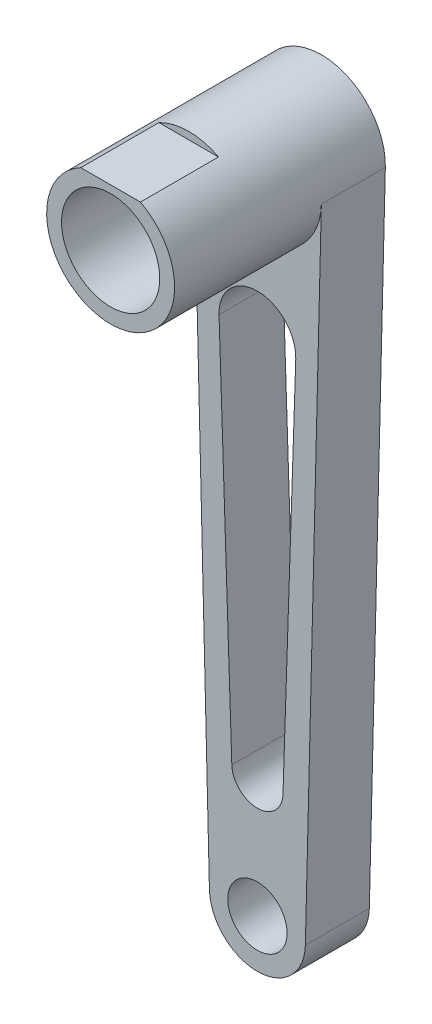
from build123d import *

# Parameters (mm, degrees)
SKETCH1_R           = 4.635
BOSS_EXTRUDE2_DEPTH = 10
SKETCH1_6_R         = 7.675
BOSS_EXTRUDE3_DEPTH = 32.94
SKETCH2_W           = 20.025396677
SKETCH2_H           = 9.808205023
CUT_EXTRUDE1_DEPTH  = 12.2


with BuildPart() as part:
    # Sketch1 → Boss-Extrude2 (new body)
    with BuildSketch(Plane.XY):
        with BuildLine():
            ThreePointArc((9.996972197, -0.246062766), (5.5e-08, -10), (-9.996972195, -0.246062876))
            Line((-9.996972195, -0.246062876), (-7.497729139, -101.784547426))
            ThreePointArc((-7.497729139, -101.784547426), (1.58e-07, -109.1), (7.497729147, -101.784547111))
            Line((7.497729147, -101.784547111), (9.996972197, -0.246062766))
        make_face()
        with BuildLine():
            Line((5.996665744, -23.199999888), (3.997777167, -83.133333141))
            ThreePointArc((3.997777167, -83.133333141), (1.93e-07, -87), (-3.997777154, -83.133333527))
            Line((-3.997777154, -83.133333527), (-5.996665745, -23.199999845))
            ThreePointArc((-5.996665745, -23.199999845), (2.1e-08, -17), (5.996665744, -23.199999888))
        make_face(mode=Mode.SUBTRACT)
        with Locations((0, -101.6)):
            Circle(SKETCH1_R, mode=Mode.SUBTRACT)
    extrude(amount=BOSS_EXTRUDE2_DEPTH)

    # Sketch1<6> → Boss-Extrude3 (add)
    with BuildSketch(Plane.XY):
        with BuildLine():
            ThreePointArc((10, 0), (-0.123040752, 9.99924302), (-9.996972195, -0.246062876))
            ThreePointArc((-9.996972195, -0.246062876), (5.5e-08, -10), (9.996972197, -0.246062766))
            ThreePointArc((9.996972197, -0.246062766), (9.999243021, -0.123040697), (10, 0))
        make_face()
        Circle(SKETCH1_6_R, mode=Mode.SUBTRACT)
    extrude(amount=BOSS_EXTRUDE3_DEPTH)

    # Sketch2 → Cut-Extrude1 (cut)
    with BuildSketch(Plane.XY.offset(32.94)):
        with Locations((-0.020605473, 13.754102512)):
            Rectangle(SKETCH2_W, SKETCH2_H)
    extrude(amount=-CUT_EXTRUDE1_DEPTH, mode=Mode.SUBTRACT)


solid = part.part
